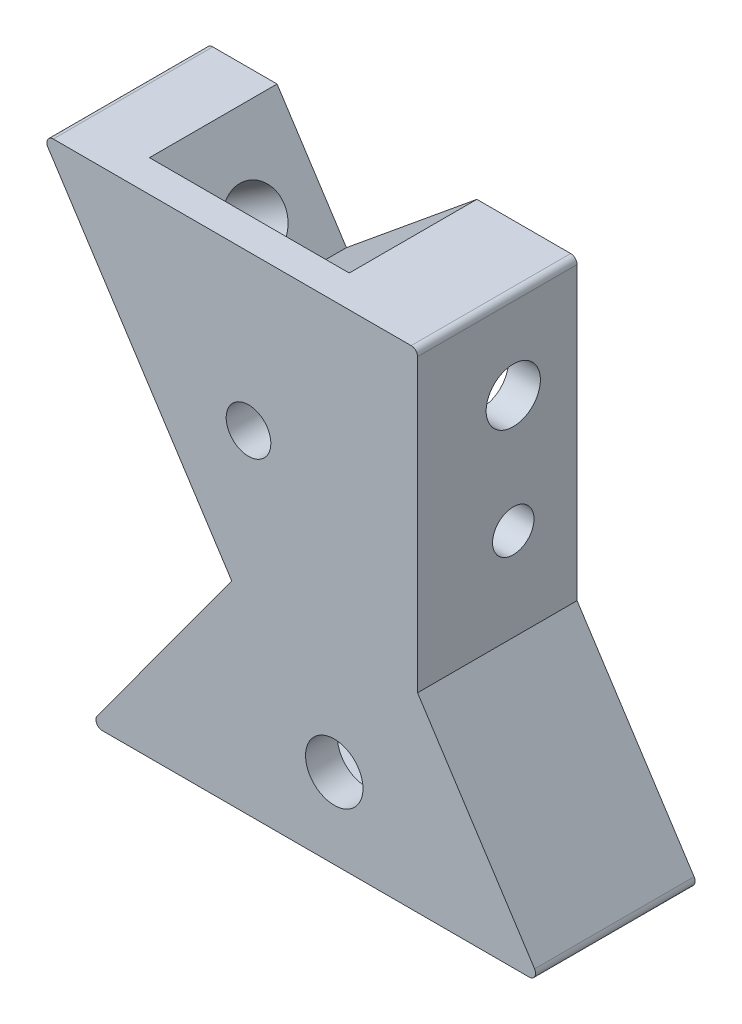
from build123d import *

# Parameters (mm, degrees)
BOSS_EXTRUDE1_DEPTH = 25
FILLET1_R           = 1
SKETCH3_R           = 3.5
SKETCH3_R_2         = 4.5
CUT_EXTRUDE1_DEPTH  = 107.547974619
SKETCH5_R           = 3.25
SKETCH5_R_2         = 4.25
CUT_EXTRUDE2_DEPTH  = 15
SKETCH6_R           = 4.5
CUT_EXTRUDE3_DEPTH  = 75.378212615
CUT_EXTRUDE4_DEPTH  = 20
SKETCH8_R           = 7.5
BOSS_EXTRUDE2_DEPTH = 2.5


with BuildPart() as part:
    # Sketch1 → Boss-Extrude1 (new body)
    with BuildSketch(Plane.XY):
        Polygon((0, 0), (70.708255785, 0), (51.368106312, 29.843722724), (51.368106312, 76.458169568), (-7.563619117, 76.458169568), (22.245139504, 30.460369589), align=None)
    extrude(amount=-BOSS_EXTRUDE1_DEPTH)

    # Fillet1
    fillet1_edges = [part.edges().sort_by_distance(p)[0] for p in [
        (-7.563619117, 76.458169568, -12.5),
        (51.368106312, 76.458169568, -12.5),
        (70.708255785, 0, -12.5),
        (0, 0, -12.5),
    ]]
    fillet(fillet1_edges, radius=FILLET1_R)

    # Sketch3 → Cut-Extrude1 (cut, through all)
    with BuildSketch(Plane.XY):
        with Locations((24.876562512, 52.188494761)):
            Circle(SKETCH3_R)
        with Locations((38.314068162, 12.548521918)):
            Circle(SKETCH3_R_2)
    extrude(amount=-CUT_EXTRUDE1_DEPTH, mode=Mode.SUBTRACT)

    # Sketch5 → Cut-Extrude2 (cut)
    with BuildSketch(Plane(origin=(51.368106312, 0, 0), x_dir=(0, 0, -1), z_dir=(1, 0, 0))):
        with Locations((15, 44.323148577)):
            Circle(SKETCH5_R)
        with Locations((15, 62.709065934)):
            Circle(SKETCH5_R_2)
    extrude(amount=-CUT_EXTRUDE2_DEPTH, mode=Mode.SUBTRACT)

    # Sketch6 → Cut-Extrude3 (cut, through all)
    with BuildSketch(Plane(origin=(29.567552266, 19.161177902, 0), x_dir=(0, 0, 1), z_dir=(-0.8391915398703581, -0.5438359673743705, 0))):
        with Locations((-15, 49.652378142)):
            Circle(SKETCH6_R)
    extrude(amount=-CUT_EXTRUDE3_DEPTH, mode=Mode.SUBTRACT)

    # Sketch7 → Cut-Extrude4 (cut)
    with BuildSketch(Plane(origin=(0, 0, -25), x_dir=(-1, 0, 0), z_dir=(0, 0, -1))):
        Polygon((-46.368106312, 71.458169568), (-46.368106312, 32.960369589), (-26.583136145, 32.960369589), (-14.069575571, 52.270004842), (-37.450537462, 71.458169568), align=None)
        Polygon((-46.63049322, 27.960369589), (-61.509903002, 5), (-9.842883626, 5), (-26.610789973, 27.960369589), align=None)
        Polygon((-35.661515688, 76.458169568), (-15.222708908, 59.68455721), (-4.352611594, 76.458169568), align=None)
    extrude(amount=-CUT_EXTRUDE4_DEPTH, mode=Mode.SUBTRACT)

    # Sketch8 → Boss-Extrude2 (add)
    with BuildSketch(Plane.XZ):
        with Locations((17.572595063, -13.182747621)):
            Circle(SKETCH8_R)
        with Locations((56.437878209, -13.182747621)):
            Circle(SKETCH8_R)
    extrude(amount=BOSS_EXTRUDE2_DEPTH)


solid = part.part
